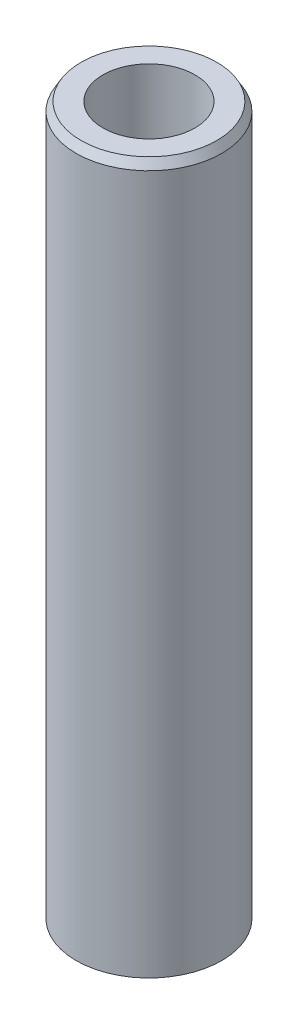
from build123d import *
from OCP.BRepFilletAPI import BRepFilletAPI_MakeChamfer

# Parameters (mm, degrees)
SKETCH1_R           = 7.5
BOSS_EXTRUDE1_DEPTH = 73.379131069
SKETCH2_R           = 4.7403169
CUT_EXTRUDE1_DEPTH  = 75.141735052
CHAMFER1_SIZE       = 0.888175583
CHAMFER1_SIZE2      = 0.512788412


with BuildPart() as part:
    # Sketch1 → Boss-Extrude1 (new body)
    with BuildSketch(Plane(origin=(0, 0, 0), x_dir=(1, 0, 0), z_dir=(0, 1, 0))):
        Circle(SKETCH1_R)
    extrude(amount=BOSS_EXTRUDE1_DEPTH)

    # Sketch2 → Cut-Extrude1 (cut, through all)
    with BuildSketch(Plane(origin=(0, 0, 0), x_dir=(1, 0, 0), z_dir=(0, 1, 0))):
        Circle(SKETCH2_R)
    extrude(amount=CUT_EXTRUDE1_DEPTH, mode=Mode.SUBTRACT)

    # Chamfer1: one chamfer whose edges measure the first distance from different faces: ONE call of the kernel's chamfer builder (chamfer() names one face for all edges)
    chamfer1_edges_1 = [part.edges().sort_by_distance(p)[0] for p in [
        (-7.5, 73.379131069, 0),
    ]]
    chamfer1_side_1 = [part.faces().sort_by_distance(p)[0] for p in [
        (-7.5, 36.689565535, 0),
    ]]
    chamfer1_edges_2 = [part.edges().sort_by_distance(p)[0] for p in [
        (-7.5, 0, 0),
    ]]
    chamfer1_side_2 = [part.faces().sort_by_distance(p)[0] for p in [
        (-7.287867966, 0, 0),
    ]]
    chamfer1 = BRepFilletAPI_MakeChamfer(part.part.solid().wrapped)
    for e in chamfer1_edges_1:
        chamfer1.Add(CHAMFER1_SIZE, CHAMFER1_SIZE2, e.wrapped, chamfer1_side_1[0].wrapped)  # the first distance lies on this face
    for e in chamfer1_edges_2:
        chamfer1.Add(CHAMFER1_SIZE, CHAMFER1_SIZE2, e.wrapped, chamfer1_side_2[0].wrapped)  # the first distance lies on this face
    add(Compound.cast(chamfer1.Shape()), mode=Mode.REPLACE)


solid = part.part
